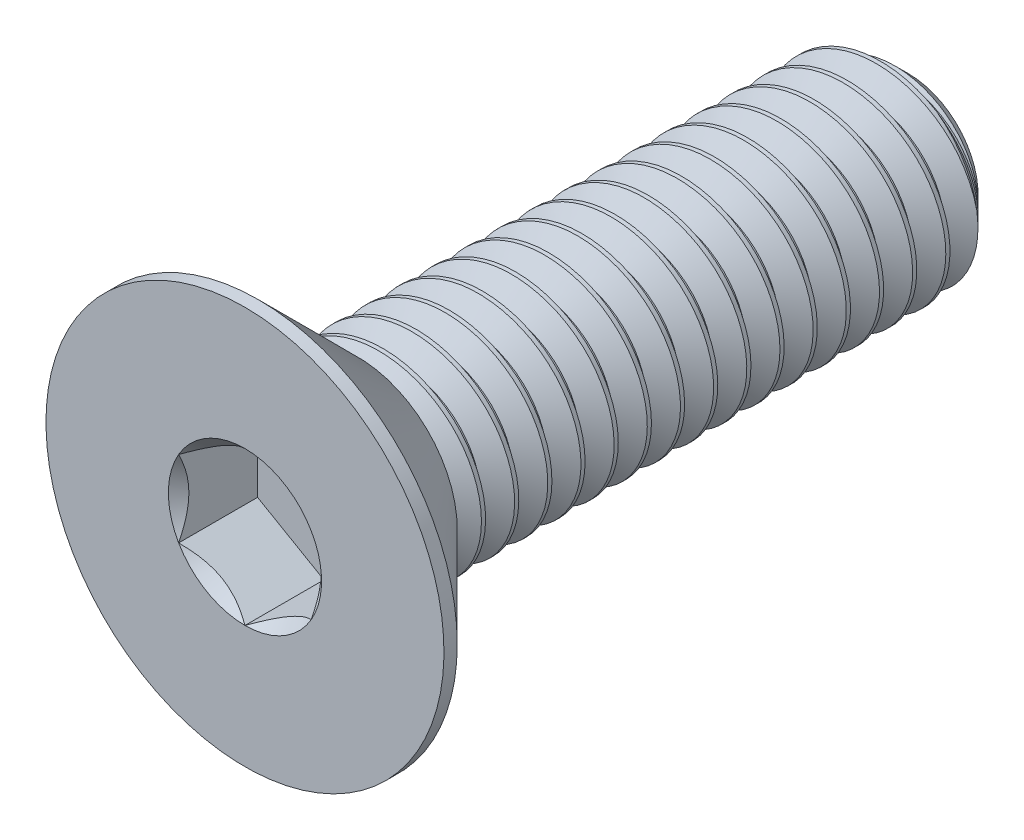
from build123d import *

# Parameters (mm, degrees)
SKETCH3_W          = 10
SKETCH3_H          = 1.5
CHAMFER1_SIZE      = 0.45
CUT_EXTRUDE1_DEPTH = 1.19
CUT_SWEEP1_PITCH   = 0.5


with BuildPart() as part:
    # Sketch3 → Revolve1 (revolve)
    with BuildSketch(Plane(origin=(0, 0, 0), x_dir=(0, 0, -1), z_dir=(1, 0, 0))):
        with Locations((0, 0.75)):
            Rectangle(SKETCH3_W, SKETCH3_H)
    revolve(axis=Axis((0, 0, -5), (0, 0, 1)))

    # Chamfer1
    chamfer1_edges = [part.edges().sort_by_distance(p)[0] for p in [
        (0, -1.5, -5),
    ]]
    chamfer(chamfer1_edges, length=CHAMFER1_SIZE)

    # Sketch6 → Revolve2 (revolve)
    with BuildSketch(Plane(origin=(0, 0, 0), x_dir=(0, 0, -1), z_dir=(1, 0, 0))):
        Polygon((-5, 3), (-4.8, 3), (-3.3, 1.5), (-3.3, 0), (-5, 0), align=None)
    revolve(axis=Axis((0, 0, -5), (0, 0, 1)))

    # Sketch8 → Cut-Extrude1 (cut)
    with BuildSketch(Plane.XY.offset(5)):
        Polygon((0, 1.154700538), (-1, 0.577350269), (-1, -0.577350269), (0, -1.154700538), (1, -0.577350269), (1, 0.577350269), align=None)
    extrude(amount=-CUT_EXTRUDE1_DEPTH, mode=Mode.SUBTRACT)

    # Cut-Extrude2 cone 1 section (through the dimple's axis) → Cut-Extrude2 (revolve, cut)
    with BuildSketch(Plane(origin=(0, 0, 5), x_dir=(0, -1, 0), z_dir=(1, 0, 0))):
        Polygon((0, 0), (1.154700538, 0), (0, 1.154700538), align=None)
    revolve(axis=Axis((0, 0, 5), (0, 0, -1)), mode=Mode.SUBTRACT)


with BuildPart() as body_2:
    # Split1: the piece on the far side of the plane
    add(part.part)
    split(bisect_by=Plane.XY.offset(3.3), keep=Keep.BOTTOM)

    # Cut-Sweep1: the profile of Sketch10 screwed along a right-hand helix of 20 turns, 6 arcs to a turn; built about Z, then put on its axis
    cut_sweep1_z = Axis((0, 0, 0), (0, 0, 1))
    cut_sweep1_corners = [(1.527063294, 0, 0.015625), (1.527063294, 0, -0.453125), (1.175240474, 0, -0.25), (1.175240474, 0, -0.1875)]
    with BuildLine(mode=Mode.PRIVATE) as cut_sweep1_profile:
        Line(cut_sweep1_corners[0], cut_sweep1_corners[1])
        Line(cut_sweep1_corners[1], cut_sweep1_corners[2])
        Line(cut_sweep1_corners[2], cut_sweep1_corners[3])
        Line(cut_sweep1_corners[3], cut_sweep1_corners[0])
    cut_sweep1_cap = Face(cut_sweep1_profile.wire())
    cut_sweep1_turn_angles = [0, 30, 60, 90, 120, 150, 180, 210, 240, 270, 300, 330, 360]
    cut_sweep1_turn_weights = [1, 0.8660254037844387, 1, 0.8660254037844387, 1, 0.8660254037844387, 1, 0.8660254037844387, 1, 0.8660254037844387, 1, 0.8660254037844387, 1]
    cut_sweep1_turn_rails = [Edge.make_bspline([Vector(p[0], p[1], 0).rotate(cut_sweep1_z, cut_sweep1_turn_angles[k]) / cut_sweep1_turn_weights[k] + Vector(0, 0, p[2] + CUT_SWEEP1_PITCH * cut_sweep1_turn_angles[k] / 360) for k in range(13)], [0, 0, 0, 1, 1, 2, 2, 3, 3, 4, 4, 5, 5, 6, 6, 6], 2, cut_sweep1_turn_weights) for p in cut_sweep1_corners]
    cut_sweep1_turn_sides = [Face.make_surface_from_curves(cut_sweep1_turn_rails[p[0]], cut_sweep1_turn_rails[p[1]]) for p in [(0, 1), (1, 2), (2, 3), (3, 0)]]
    cut_sweep1 = Plane(origin=(0, 0, -5), x_dir=(0, 1, 0), z_dir=(0, 0, 1)) * Solid(Shell([*[p.moved(Location((0, 0, CUT_SWEEP1_PITCH * i))) for i in range(20) for p in cut_sweep1_turn_sides], cut_sweep1_cap, cut_sweep1_cap.rotate(cut_sweep1_z, 7200).moved(Location((0, 0, CUT_SWEEP1_PITCH * 7200 / 360)))]))
    add(cut_sweep1, mode=Mode.SUBTRACT)


with BuildPart() as part_1:
    add(part.part)

    # Split1
    split(bisect_by=Plane.XY.offset(3.3), keep=Keep.TOP)


with BuildPart() as body_2_1:
    add(body_2.part)

    # Combine1: union part
    add(part_1.part)


solid = body_2_1.part
